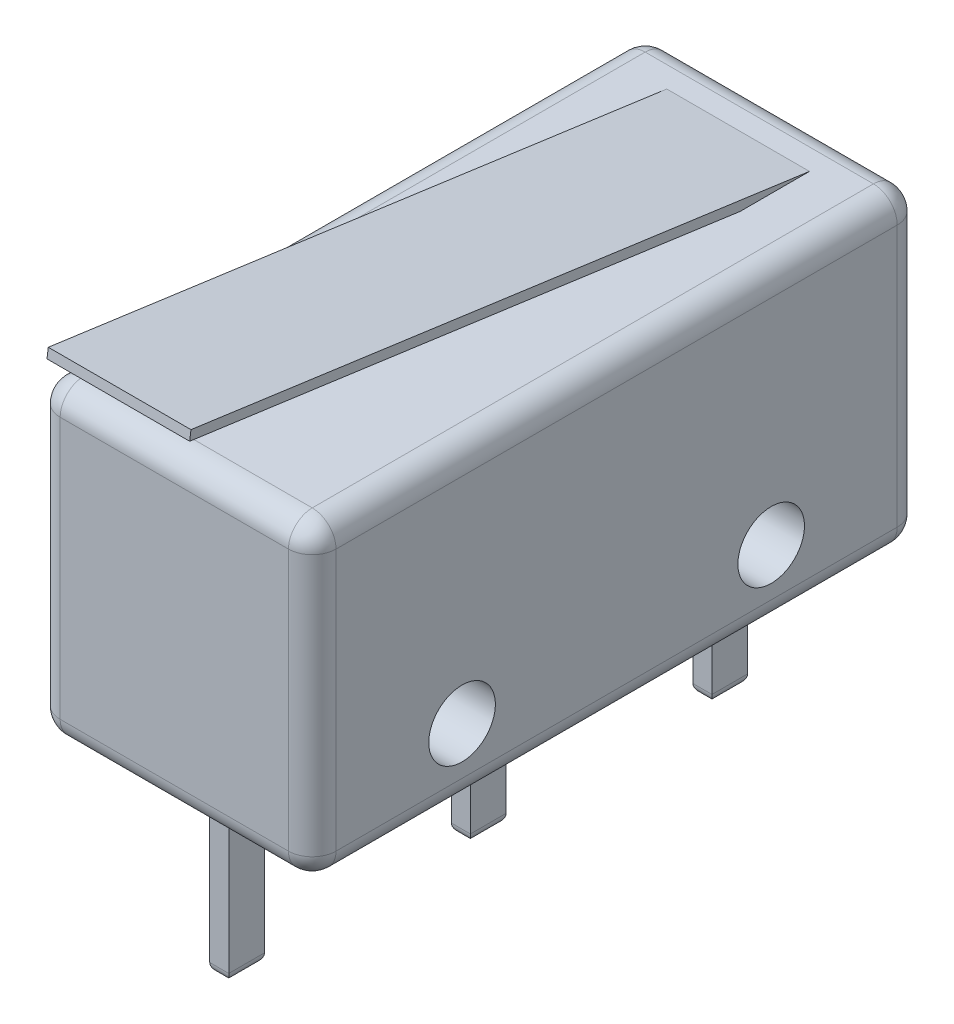
from build123d import *

# Parameters (mm, degrees)
SKETCH3_W           = 12.8
SKETCH3_H           = 6.5
BOSS_EXTRUDE1_DEPTH = 5.8
SKETCH4_W           = 0.4
SKETCH4_H           = 0.375
SKETCH4_H_2         = 0.75
BOSS_EXTRUDE2_DEPTH = 3.5
FILLET1_R           = 0.2
CUT_EXTRUDE1_REACH  = 12.962
SKETCH5_R           = 0.7
BOSS_EXTRUDE4_START = -1.4
BOSS_EXTRUDE4_DEPTH = 3
FILLET2_R           = 0.5


with BuildPart() as part:
    # Sketch3 → Boss-Extrude1 (new body)
    with BuildSketch(Plane(origin=(0, 0, 0), x_dir=(0, 0, -1), z_dir=(1, 0, 0))):
        Rectangle(SKETCH3_W, SKETCH3_H)
    extrude(amount=BOSS_EXTRUDE1_DEPTH)

    # Sketch4 → Boss-Extrude2 (add)
    with BuildSketch(Plane.XZ.offset(3.25)):
        with Locations((2.9, -0.1875)):
            Rectangle(SKETCH4_W, SKETCH4_H)
        with Locations((2.9, 0.1875)):
            Rectangle(SKETCH4_W, SKETCH4_H)
        with Locations((2.9, 5.08)):
            Rectangle(SKETCH4_W, SKETCH4_H_2)
        with Locations((2.9, -5.08)):
            Rectangle(SKETCH4_W, SKETCH4_H_2)
    extrude(amount=BOSS_EXTRUDE2_DEPTH)

    # Fillet1
    fillet1_edges = [part.edges().sort_by_distance(p)[0] for p in [
        (3.1, -6.75, 0),
        (2.9, -6.75, 0.375),
        (2.7, -6.75, 0),
        (2.9, -6.75, -0.375),
        (3.1, -6.75, 5.08),
        (2.9, -6.75, 5.455),
        (2.7, -6.75, 5.08),
        (2.9, -6.75, 4.705),
        (2.9, -6.75, -4.705),
        (2.7, -6.75, -5.08),
        (2.9, -6.75, -5.455),
        (3.1, -6.75, -5.08),
    ]]
    fillet(fillet1_edges, radius=FILLET1_R - 0.0001)  # a hair under: the kernel refuses the full size

    # Sketch5 → Cut-Extrude1 (cut, up to next)
    with BuildSketch(Plane.ZY, mode=Mode.PRIVATE) as cut_extrude1_sk1:
        with Locations((-3.25, -1.75)):
            Circle(SKETCH5_R)
    cut_extrude1_tool1 = extrude(cut_extrude1_sk1.sketch, amount=-CUT_EXTRUDE1_REACH, mode=Mode.PRIVATE) & part.part
    # Sketch5 → Cut-Extrude1 (cut, up to next)
    with BuildSketch(Plane.ZY, mode=Mode.PRIVATE) as cut_extrude1_sk2:
        with Locations((3.25, -1.75)):
            Circle(SKETCH5_R)
    cut_extrude1_tool2 = extrude(cut_extrude1_sk2.sketch, amount=-CUT_EXTRUDE1_REACH, mode=Mode.PRIVATE) & part.part
    add(cut_extrude1_tool1.solids().sort_by_distance((0, -1.75, -3.25))[0], mode=Mode.SUBTRACT)
    add(cut_extrude1_tool2.solids().sort_by_distance((0, -1.75, 3.25))[0], mode=Mode.SUBTRACT)

    # Sketch6 → Boss-Extrude4 (add)
    with BuildSketch(Plane.ZY.offset(BOSS_EXTRUDE4_START)):
        Polygon((-5.455, 3.25), (7.55, 5.05), (7.577420264, 4.851888594), (-3.996224829, 3.25), align=None)
    extrude(amount=-BOSS_EXTRUDE4_DEPTH)

    # Fillet2
    fillet2_edges = [part.edges().sort_by_distance(p)[0] for p in [
        (5.8, 0, 6.4),
        (5.8, -3.25, 0),
        (5.8, 0, -6.4),
        (0, -3.25, 0),
        (0, 0, 6.4),
        (0, 3.25, 0),
        (0, 0, -6.4),
        (2.9, -3.25, -6.4),
        (2.9, -3.25, 6.4),
        (2.9, 3.25, 6.4),
        (2.9, 3.25, -6.4),
        (5.8, 3.25, 0),
    ]]
    fillet(fillet2_edges, radius=FILLET2_R)


solid = part.part
